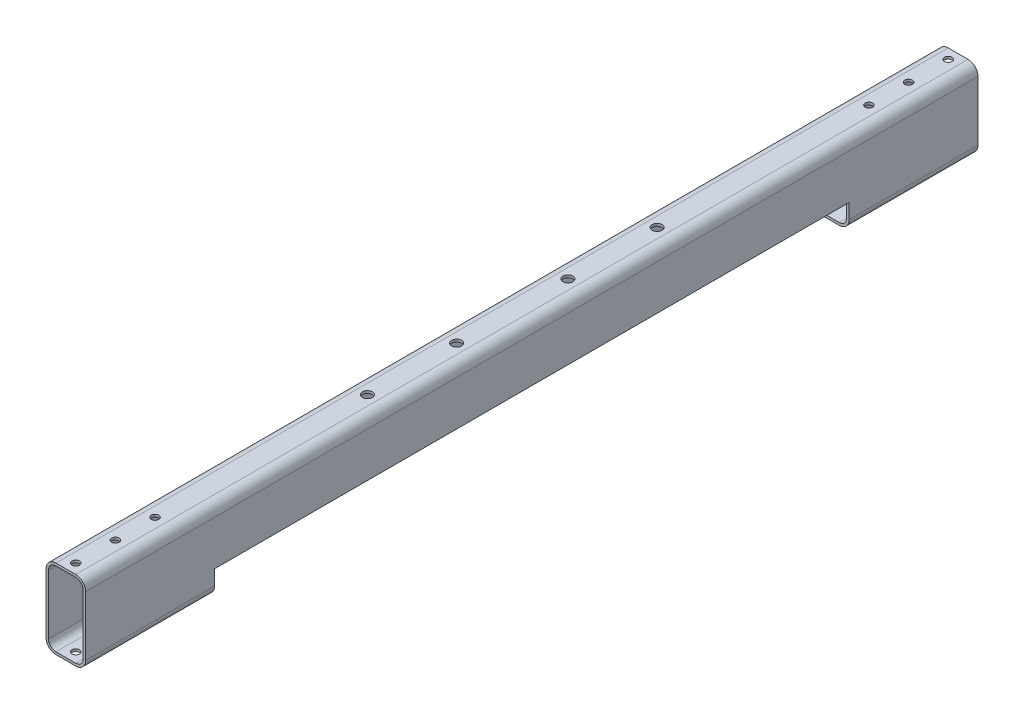
from build123d import *

# Parameters (mm, degrees)
EXTRUDE_THIN1_DEPTH            = 571.5
F_3_16_0_1875_DIAMETER_HOLE1_D = 4.7625
SKETCH5_W                      = 406.4
SKETCH5_H                      = 15.875
CUT_EXTRUDE1_DEPTH             = 573.627776134
F_1_4_0_25_DIAMETER_HOLE1_D    = 6.35
E_0_25_DIAMETER_HOLE1_D        = 6.35
E_0_25_DIAMETER_HOLE1_DEPTH    = 6.35
E_0_25_DIAMETER_HOLE1_TIP      = 1.907732465


with BuildPart() as part:
    # Sketch1 → Extrude-Thin1 (new body)
    with BuildSketch(Plane.XY):
        with BuildLine():
            Line((-12.7, 19.05), (-12.7, -19.05))
            ThreePointArc((-12.7, -19.05), (-10.840128061, -23.540128061), (-6.35, -25.4))
            Line((-6.35, -25.4), (6.35, -25.4))
            ThreePointArc((6.35, -25.4), (10.840128061, -23.540128061), (12.7, -19.05))
            Line((12.7, -19.05), (12.7, 19.05))
            ThreePointArc((12.7, 19.05), (10.840128061, 23.540128061), (6.35, 25.4))
            Line((6.35, 25.4), (-6.35, 25.4))
            ThreePointArc((-6.35, 25.4), (-10.840128061, 23.540128061), (-12.7, 19.05))
        make_face()
        with BuildLine():
            Line((-11.1125, 19.05), (-11.1125, -19.05))
            ThreePointArc((-11.1125, -19.05), (-9.717596045, -22.417596045), (-6.35, -23.8125))
            Line((-6.35, -23.8125), (6.35, -23.8125))
            ThreePointArc((6.35, -23.8125), (9.717596045, -22.417596045), (11.1125, -19.05))
            Line((11.1125, -19.05), (11.1125, 19.05))
            ThreePointArc((11.1125, 19.05), (9.717596045, 22.417596045), (6.35, 23.8125))
            Line((6.35, 23.8125), (-6.35, 23.8125))
            ThreePointArc((-6.35, 23.8125), (-9.717596045, 22.417596045), (-11.1125, 19.05))
        make_face(mode=Mode.SUBTRACT)
    extrude(amount=EXTRUDE_THIN1_DEPTH)

    # 3/16 (0.1875) Diameter Hole1 (through all)
    with Locations(Plane(origin=(0, 25.4, 565.15), x_dir=(0, 0, 1), z_dir=(0, 1, 0))):
        with Locations((0, 0), (-558.8, 0), (-533.4, 0), (-508, 0), (-25.4, 0), (-50.8, 0)):
            Hole(F_3_16_0_1875_DIAMETER_HOLE1_D / 2)

    # Sketch5 → Cut-Extrude1 (cut, through all)
    with BuildSketch(Plane(origin=(12.7, 0, 0), x_dir=(0, 0, -1), z_dir=(1, 0, 0))):
        with Locations((-285.75, -17.4625)):
            Rectangle(SKETCH5_W, SKETCH5_H)
    extrude(amount=-CUT_EXTRUDE1_DEPTH, mode=Mode.SUBTRACT)

    # 1/4 (0.25) Diameter Hole1 (through all)
    with Locations(Plane(origin=(0, 25.4, 0), x_dir=(1, 0, 0), z_dir=(0, 1, 0))):
        with Locations((0, -321.183), (0, -378.333), (0, -192.786), (0, -249.936)):
            Hole(F_1_4_0_25_DIAMETER_HOLE1_D / 2)

    # E (0.25) Diameter Hole1
    with Locations(Plane.ZY.offset(12.7)):
        with Locations((103.886, 17.145), (103.886, 1.27), (116.586, 8.89), (454.914, 8.89), (467.614, 1.27), (467.614, 17.145)):
            Hole(E_0_25_DIAMETER_HOLE1_D / 2, depth=E_0_25_DIAMETER_HOLE1_DEPTH)
            with Locations((0, 0, -(E_0_25_DIAMETER_HOLE1_DEPTH + E_0_25_DIAMETER_HOLE1_TIP / 2))):  # 118° drill point
                Cone(0, E_0_25_DIAMETER_HOLE1_D / 2, E_0_25_DIAMETER_HOLE1_TIP, mode=Mode.SUBTRACT)


solid = part.part
